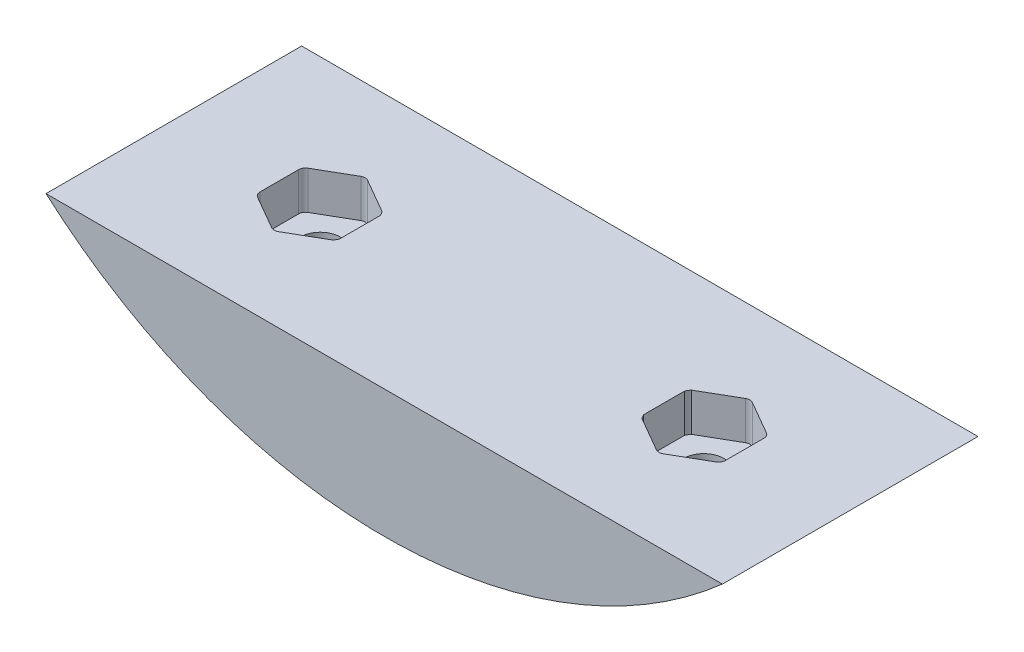
from build123d import *

# Parameters (mm, degrees)
BOSS_EXTRUDE1_DEPTH     = 25.4
CUT_EXTRUDE1_DEPTH      = 73.955945611
CUT_EXTRUDE1_DEPTH_BACK = 73.955945611
SKETCH2_R               = 2
CUT_EXTRUDE2_DEPTH      = 3.81


with BuildPart() as part:
    # Sketch1 → Boss-Extrude1 (new body)
    with BuildSketch(Plane.XY):
        with BuildLine():
            Line((0, 0), (67.202083301, 0))
            ThreePointArc((67.202083301, 0), (33.601041651, -12.7), (0, 0))
        make_face()
    extrude(amount=BOSS_EXTRUDE1_DEPTH)

    # Sketch2 → Cut-Extrude1 (cut, two sides: drawn at the far end of the back side and taken through both)
    with BuildSketch(Plane(origin=(0, 0, 0), x_dir=(1, 0, 0), z_dir=(0, 1, 0)).offset(-CUT_EXTRUDE1_DEPTH_BACK)):
        with Locations((14.551041651, -12.7)):
            Circle(SKETCH2_R)
        with Locations((52.651041651, -12.7)):
            Circle(SKETCH2_R)
    extrude(amount=CUT_EXTRUDE1_DEPTH + CUT_EXTRUDE1_DEPTH_BACK, mode=Mode.SUBTRACT)

    # Sketch3 → Cut-Extrude2 (cut)
    with BuildSketch(Plane(origin=(0, 0, 0), x_dir=(1, 0, 0), z_dir=(0, 1, 0))):
        with BuildLine():
            Line((56.714596369, -12.7), (56.714596369, -14.619689645))
            ThreePointArc((56.714596369, -14.619689645), (56.624163517, -14.957189645), (56.377096369, -15.204256793))
            Line((56.377096369, -15.204256793), (54.665417086, -16.192495288))
            Line((54.665417086, -16.192495288), (53.052096369, -17.123946438))
            ThreePointArc((53.052096369, -17.123946438), (52.714596369, -17.21437929), (52.377096369, -17.123946438))
            Line((52.377096369, -17.123946438), (50.665417086, -16.135707943))
            Line((50.665417086, -16.135707943), (48.96232559, -15.152427609))
            ThreePointArc((48.96232559, -15.152427609), (48.822508253, -14.947098122), (48.714596369, -14.723348012))
            Line((48.714596369, -14.723348012), (48.714596369, -12.7))
            Line((48.714596369, -12.7), (48.714596369, -10.676651988))
            ThreePointArc((48.714596369, -10.676651988), (48.822508253, -10.452901878), (48.96232559, -10.247572391))
            Line((48.96232559, -10.247572391), (50.665417086, -9.264292057))
            Line((50.665417086, -9.264292057), (52.377096369, -8.276053562))
            ThreePointArc((52.377096369, -8.276053562), (52.714596369, -8.18562071), (53.052096369, -8.276053562))
            Line((53.052096369, -8.276053562), (54.665417086, -9.207504712))
            Line((54.665417086, -9.207504712), (56.377096369, -10.195743207))
            ThreePointArc((56.377096369, -10.195743207), (56.624163517, -10.442810355), (56.714596369, -10.780310355))
            Line((56.714596369, -10.780310355), (56.714596369, -12.7))
        make_face()
        with BuildLine():
            Line((10.824986932, -15.204256793), (12.536666215, -16.192495288))
            Line((12.536666215, -16.192495288), (14.149986932, -17.123946438))
            ThreePointArc((14.149986932, -17.123946438), (14.487486932, -17.21437929), (14.824986932, -17.123946438))
            Line((14.824986932, -17.123946438), (16.536666215, -16.135707943))
            Line((16.536666215, -16.135707943), (18.239757711, -15.152427609))
            ThreePointArc((18.239757711, -15.152427609), (18.379575048, -14.947098122), (18.487486932, -14.723348012))
            Line((18.487486932, -14.723348012), (18.487486932, -12.7))
            Line((18.487486932, -12.7), (18.487486932, -10.676651988))
            ThreePointArc((18.487486932, -10.676651988), (18.379575048, -10.452901878), (18.239757711, -10.247572391))
            Line((18.239757711, -10.247572391), (16.536666215, -9.264292057))
            Line((16.536666215, -9.264292057), (14.824986932, -8.276053562))
            ThreePointArc((14.824986932, -8.276053562), (14.487486932, -8.18562071), (14.149986932, -8.276053562))
            Line((14.149986932, -8.276053562), (12.536666215, -9.207504712))
            Line((12.536666215, -9.207504712), (10.824986932, -10.195743207))
            ThreePointArc((10.824986932, -10.195743207), (10.577919784, -10.442810355), (10.487486932, -10.780310355))
            Line((10.487486932, -10.780310355), (10.487486932, -12.7))
            Line((10.487486932, -12.7), (10.487486932, -14.619689645))
            ThreePointArc((10.487486932, -14.619689645), (10.577919784, -14.957189645), (10.824986932, -15.204256793))
        make_face()
    extrude(amount=-CUT_EXTRUDE2_DEPTH, mode=Mode.SUBTRACT)


solid = part.part
